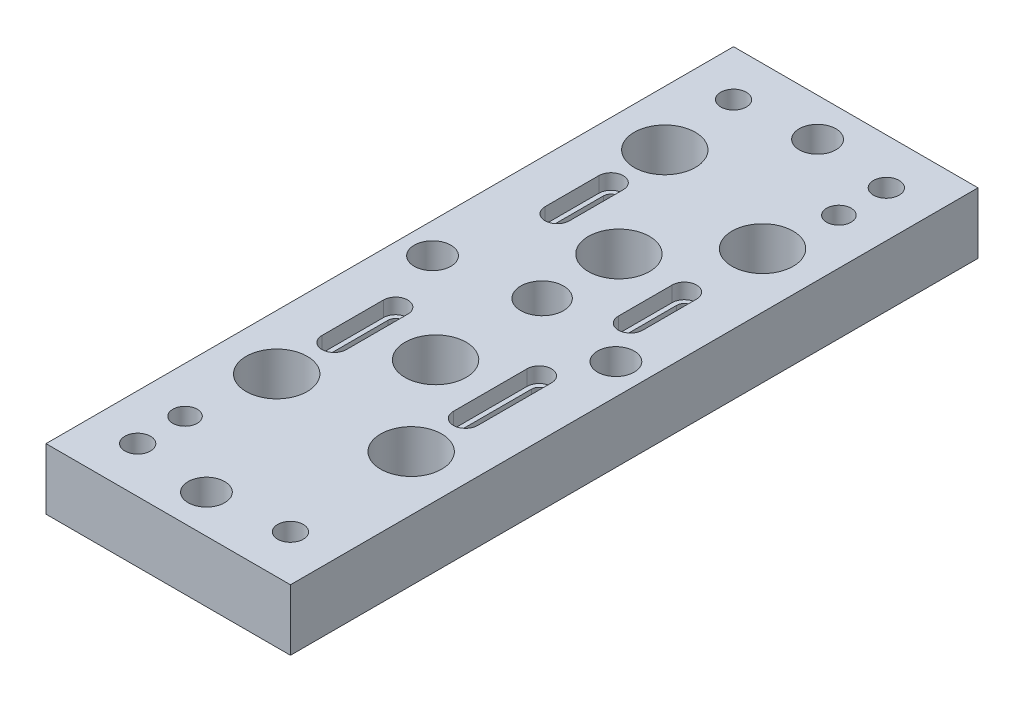
from build123d import *

# Parameters (mm, degrees)
SKETCH1_W                                    = 80
SKETCH1_H                                    = 225
BOSS_EXTRUDE1_DEPTH                          = 20
CUT_EXTRUDE1_REACH                           = 123.063
CUT_EXTRUDE2_DEPTH                           = 5
CBORE_FOR_M8_HEX_SOCKET_HEAD_CAP_SCR_2_COUNT = 2
CBORE_FOR_M8_HEX_SOCKET_HEAD_CAP_SCR_2_PITCH = 50
CBORE_FOR_M8_HEX_SOCKET_HEAD_CAP_SCR_3_COUNT = 2
CBORE_FOR_M8_HEX_SOCKET_HEAD_CAP_SCR_3_PITCH = 201.308221392
CBORE_FOR_M8_HEX_SOCKET_HEAD_CAP_SCR_4_COUNT = 2
CBORE_FOR_M8_HEX_SOCKET_HEAD_CAP_SCR_4_PITCH = 195
F_8_0MM_DOWEL_HOLE1_D                        = 8
SKETCH11_R                                   = 10
CUT_EXTRUDE3_DEPTH                           = 122.063000128
CUT_EXTRUDE4_REACH                           = 123.063
SKETCH13_R                                   = 6
CUT_EXTRUDE5_REACH                           = 123.063
SKETCH14_R                                   = 7


with BuildPart() as part:
    # Sketch1 → Boss-Extrude1 (new body)
    with BuildSketch(Plane(origin=(0, 0, 0), x_dir=(1, 0, 0), z_dir=(0, 1, 0))):
        Rectangle(SKETCH1_W, SKETCH1_H)
    extrude(amount=-BOSS_EXTRUDE1_DEPTH)

    # Sketch2 → Cut-Extrude1 (cut, up to next)
    with BuildSketch(Plane(origin=(0, 0, 0), x_dir=(1, 0, 0), z_dir=(0, 1, 0)), mode=Mode.PRIVATE) as cut_extrude1_sk1:
        with BuildLine():
            Line((24, 17.31), (24, 34.91))
            ThreePointArc((24, 34.91), (21.5, 37.41), (19, 34.91))
            Line((19, 34.91), (19, 17.31))
            ThreePointArc((19, 17.31), (21.5, 14.81), (24, 17.31))
        make_face()
    cut_extrude1_tool1 = extrude(cut_extrude1_sk1.sketch, amount=-CUT_EXTRUDE1_REACH, mode=Mode.PRIVATE) & part.part
    # Sketch2 → Cut-Extrude1 (cut, up to next)
    with BuildSketch(Plane(origin=(0, 0, 0), x_dir=(1, 0, 0), z_dir=(0, 1, 0)), mode=Mode.PRIVATE) as cut_extrude1_sk2:
        with BuildLine():
            Line((24, -36.69), (24, -12.59))
            ThreePointArc((24, -12.59), (21.5, -10.09), (19, -12.59))
            Line((19, -12.59), (19, -36.69))
            ThreePointArc((19, -36.69), (21.5, -39.19), (24, -36.69))
        make_face()
    cut_extrude1_tool2 = extrude(cut_extrude1_sk2.sketch, amount=-CUT_EXTRUDE1_REACH, mode=Mode.PRIVATE) & part.part
    # Sketch2 → Cut-Extrude1 (cut, up to next)
    with BuildSketch(Plane(origin=(0, 0, 0), x_dir=(1, 0, 0), z_dir=(0, 1, 0)), mode=Mode.PRIVATE) as cut_extrude1_sk3:
        with BuildLine():
            Line((-24, -16.59), (-24, -36.69))
            ThreePointArc((-24, -36.69), (-21.5, -39.19), (-19, -36.69))
            Line((-19, -36.69), (-19, -16.59))
            ThreePointArc((-19, -16.59), (-21.5, -14.09), (-24, -16.59))
        make_face()
    cut_extrude1_tool3 = extrude(cut_extrude1_sk3.sketch, amount=-CUT_EXTRUDE1_REACH, mode=Mode.PRIVATE) & part.part
    # Sketch2 → Cut-Extrude1 (cut, up to next)
    with BuildSketch(Plane(origin=(0, 0, 0), x_dir=(1, 0, 0), z_dir=(0, 1, 0)), mode=Mode.PRIVATE) as cut_extrude1_sk4:
        with BuildLine():
            Line((-24, 53.91), (-24, 36.31))
            ThreePointArc((-24, 36.31), (-21.5, 33.81), (-19, 36.31))
            Line((-19, 36.31), (-19, 53.91))
            ThreePointArc((-19, 53.91), (-21.5, 56.41), (-24, 53.91))
        make_face()
    cut_extrude1_tool4 = extrude(cut_extrude1_sk4.sketch, amount=-CUT_EXTRUDE1_REACH, mode=Mode.PRIVATE) & part.part
    add(cut_extrude1_tool1.solids().sort_by_distance((21.5, 0, -26.11))[0], mode=Mode.SUBTRACT)
    add(cut_extrude1_tool2.solids().sort_by_distance((21.5, 0, 24.64))[0], mode=Mode.SUBTRACT)
    add(cut_extrude1_tool3.solids().sort_by_distance((-21.5, 0, 26.64))[0], mode=Mode.SUBTRACT)
    add(cut_extrude1_tool4.solids().sort_by_distance((-21.5, 0, -45.11))[0], mode=Mode.SUBTRACT)

    # Sketch3 → Cut-Extrude2 (cut)
    with BuildSketch(Plane(origin=(0, 0, 0), x_dir=(1, 0, 0), z_dir=(0, 1, 0))):
        with BuildLine():
            Line((-17.5, 36.31), (-17.5, 53.91))
            ThreePointArc((-17.5, 53.91), (-21.5, 57.91), (-25.5, 53.91))
            Line((-25.5, 53.91), (-25.5, 36.31))
            ThreePointArc((-25.5, 36.31), (-21.5, 32.31), (-17.5, 36.31))
        make_face()
        with BuildLine():
            Line((25.5, 17.31), (25.5, 34.91))
            ThreePointArc((25.5, 34.91), (21.5, 38.91), (17.5, 34.91))
            Line((17.5, 34.91), (17.5, 17.31))
            ThreePointArc((17.5, 17.31), (21.5, 13.31), (25.5, 17.31))
        make_face()
        with BuildLine():
            Line((25.5, -36.69), (25.5, -12.59))
            ThreePointArc((25.5, -12.59), (21.5, -8.59), (17.5, -12.59))
            Line((17.5, -12.59), (17.5, -36.69))
            ThreePointArc((17.5, -36.69), (21.5, -40.69), (25.5, -36.69))
        make_face()
        with BuildLine():
            Line((-25.5, -16.59), (-25.5, -36.69))
            ThreePointArc((-25.5, -36.69), (-21.5, -40.69), (-17.5, -36.69))
            Line((-17.5, -36.69), (-17.5, -16.59))
            ThreePointArc((-17.5, -16.59), (-21.5, -12.59), (-25.5, -16.59))
        make_face()
    extrude(amount=-CUT_EXTRUDE2_DEPTH, mode=Mode.SUBTRACT)

    # Sketch6 → CBORE for M8 Hex Socket Head Cap Screw1 (revolve, cut)
    with BuildSketch(Plane(origin=(25, -20, -97.5), x_dir=(0, 0, -1), z_dir=(1, 0, 0))):
        Polygon((0, 0), (0, 20), (4.2, 20), (4.2, 8.6), (7.5, 8.6), (7.5, 0.025), (7.525, 0), align=None)
    cbore_for_m8_hex_socket_head_cap_screw1 = revolve(axis=Axis((25, -26.35, -97.5), (0, 1, 0)), mode=Mode.SUBTRACT)

    # CBORE for M8 Hex Socket Head Cap Scr 2: CBORE for M8 Hex Socket Head Cap Screw1 ×2
    with Locations(*[(-i * CBORE_FOR_M8_HEX_SOCKET_HEAD_CAP_SCR_2_PITCH, 0, 0) for i in range(1, CBORE_FOR_M8_HEX_SOCKET_HEAD_CAP_SCR_2_COUNT)]):
        add(cbore_for_m8_hex_socket_head_cap_screw1, mode=Mode.SUBTRACT)

    # CBORE for M8 Hex Socket Head Cap Scr 3: CBORE for M8 Hex Socket Head Cap Screw1 ×2
    with Locations(*[Vector(-0.24837535026770385, 0, 0.968663866044045) * (i * CBORE_FOR_M8_HEX_SOCKET_HEAD_CAP_SCR_3_PITCH) for i in range(1, CBORE_FOR_M8_HEX_SOCKET_HEAD_CAP_SCR_3_COUNT)]):
        add(cbore_for_m8_hex_socket_head_cap_screw1, mode=Mode.SUBTRACT)

    # CBORE for M8 Hex Socket Head Cap Scr 4: CBORE for M8 Hex Socket Head Cap Screw1 ×2
    with Locations(*[(0, 0, i * CBORE_FOR_M8_HEX_SOCKET_HEAD_CAP_SCR_4_PITCH) for i in range(1, CBORE_FOR_M8_HEX_SOCKET_HEAD_CAP_SCR_4_COUNT)]):
        add(cbore_for_m8_hex_socket_head_cap_screw1, mode=Mode.SUBTRACT)

    # Ø8.0mm Dowel Hole1 (through all)
    with Locations(Plane(origin=(0, -20, 0), x_dir=(-1, 0, 0), z_dir=(0, -1, 0))):
        with Locations((-25, 81.975), (25, -82)):
            Hole(F_8_0MM_DOWEL_HOLE1_D / 2)

    # Sketch11 → Cut-Extrude3 (cut, through all)
    with BuildSketch(Plane.XZ.offset(20)):
        with Locations((-22, 55)):
            Circle(SKETCH11_R)
        with Locations((22, 55)):
            Circle(SKETCH11_R)
        with Locations((-22, -72)):
            Circle(SKETCH11_R)
        with Locations((22, -60)):
            Circle(SKETCH11_R)
        with Locations((0, -35)):
            Circle(SKETCH11_R)
        with Locations((0, 25)):
            Circle(SKETCH11_R)
    extrude(amount=-CUT_EXTRUDE3_DEPTH, mode=Mode.SUBTRACT)

    # Sketch13 → Cut-Extrude4 (cut, up to next)
    with BuildSketch(Plane(origin=(0, 0, 0), x_dir=(1, 0, 0), z_dir=(0, 1, 0)), mode=Mode.PRIVATE) as cut_extrude4_sk1:
        with Locations((0, 100)):
            Circle(SKETCH13_R)
    cut_extrude4_tool1 = extrude(cut_extrude4_sk1.sketch, amount=-CUT_EXTRUDE4_REACH, mode=Mode.PRIVATE) & part.part
    # Sketch13 → Cut-Extrude4 (cut, up to next)
    with BuildSketch(Plane(origin=(0, 0, 0), x_dir=(1, 0, 0), z_dir=(0, 1, 0)), mode=Mode.PRIVATE) as cut_extrude4_sk2:
        with Locations((0, -100)):
            Circle(SKETCH13_R)
    cut_extrude4_tool2 = extrude(cut_extrude4_sk2.sketch, amount=-CUT_EXTRUDE4_REACH, mode=Mode.PRIVATE) & part.part
    # Sketch13 → Cut-Extrude4 (cut, up to next)
    with BuildSketch(Plane(origin=(0, 0, 0), x_dir=(1, 0, 0), z_dir=(0, 1, 0)), mode=Mode.PRIVATE) as cut_extrude4_sk3:
        with Locations((-30, 4)):
            Circle(SKETCH13_R)
    cut_extrude4_tool3 = extrude(cut_extrude4_sk3.sketch, amount=-CUT_EXTRUDE4_REACH, mode=Mode.PRIVATE) & part.part
    # Sketch13 → Cut-Extrude4 (cut, up to next)
    with BuildSketch(Plane(origin=(0, 0, 0), x_dir=(1, 0, 0), z_dir=(0, 1, 0)), mode=Mode.PRIVATE) as cut_extrude4_sk4:
        with Locations((30, 4)):
            Circle(SKETCH13_R)
    cut_extrude4_tool4 = extrude(cut_extrude4_sk4.sketch, amount=-CUT_EXTRUDE4_REACH, mode=Mode.PRIVATE) & part.part
    add(cut_extrude4_tool1.solids().sort_by_distance((0, 0, -100))[0], mode=Mode.SUBTRACT)
    add(cut_extrude4_tool2.solids().sort_by_distance((0, 0, 100))[0], mode=Mode.SUBTRACT)
    add(cut_extrude4_tool3.solids().sort_by_distance((-30, 0, -4))[0], mode=Mode.SUBTRACT)
    add(cut_extrude4_tool4.solids().sort_by_distance((30, 0, -4))[0], mode=Mode.SUBTRACT)

    # Sketch14 → Cut-Extrude5 (cut, up to next)
    with BuildSketch(Plane(origin=(0, 0, 0), x_dir=(1, 0, 0), z_dir=(0, 1, 0)), mode=Mode.PRIVATE) as cut_extrude5_sk1:
        with Locations((0, 9.86)):
            Circle(SKETCH14_R)
    cut_extrude5_tool1 = extrude(cut_extrude5_sk1.sketch, amount=-CUT_EXTRUDE5_REACH, mode=Mode.PRIVATE) & part.part
    add(cut_extrude5_tool1.solids().sort_by_distance((0, 0, -9.86))[0], mode=Mode.SUBTRACT)


solid = part.part
